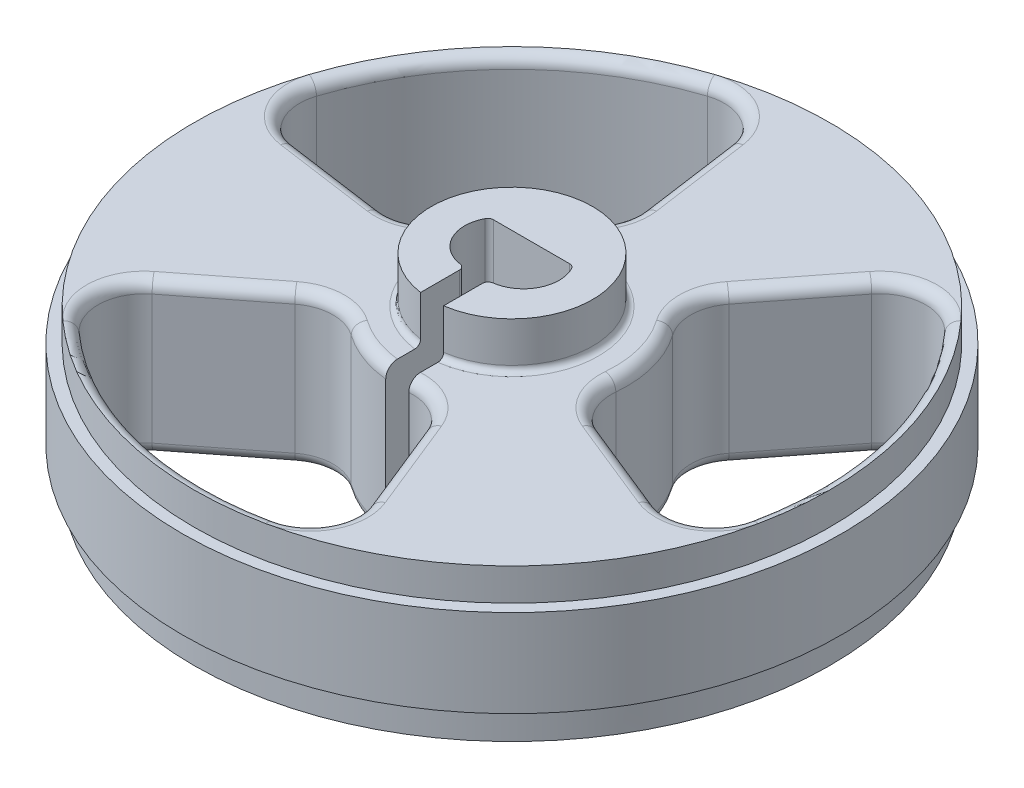
from build123d import *

# Parameters (mm, degrees)
CUT_EXTRUDE1_DEPTH       = 22.272987566
FILLET1_R                = 2
FILLET2_R                = 0.5
CIRPATTERN1_COUNT        = 3
FILLET1_OF_CIRPATTERN1_R = 2
FILLET2_OF_CIRPATTERN1_R = 0.5
CUT_EXTRUDE3_DEPTH       = 22.975895925
FILLET3_R                = 0.25
FILLET4_R                = 0.25


with BuildPart() as part:
    # Sketch1 → Revolve1 (revolve)
    with BuildSketch(Plane(origin=(0, 0, 0), x_dir=(0, 0, -1), z_dir=(1, 0, 0)), mode=Mode.PRIVATE) as revolve1_sk:
        Polygon((0, -4.3), (13.8, -4.3), (13.8, -2.9), (14.3, -2.9), (14.3, 0.9), (13.8, 0.9), (13.8, 2.3), (3.5, 2.3), (3.5, 4.3), (0, 4.3), align=None)
    revolve(revolve1_sk.sketch.rotate(Axis((0, 7.622905435, 0), (0, -1, 0)), 180), axis=Axis((0, 7.622905435, 0), (0, -1, 0)))

    # Sketch2 → Cut-Extrude1 (cut, through all)
    with BuildSketch(Plane(origin=(0, 2.3, 0), x_dir=(1, 0, 0), z_dir=(0, 1, 0))):
        with BuildLine():
            Line((-1.851002243, 13.170565314), (-0.695865505, 4.951340344))
            ThreePointArc((-0.695865505, 4.951340344), (-3.535533906, 3.535533906), (-4.951340344, 0.695865505))
            Line((-4.951340344, 0.695865505), (-13.170565314, 1.851002243))
            ThreePointArc((-13.170565314, 1.851002243), (-9.40452019, 9.40452019), (-1.851002243, 13.170565314))
        make_face()
    cut_extrude1 = extrude(amount=-CUT_EXTRUDE1_DEPTH, mode=Mode.SUBTRACT)

    # Fillet1
    fillet1_edges = [part.edges().sort_by_distance(p)[0] for p in [
        (-13.170565314, -1, -1.851002243),
        (-1.851002243, -1, -13.170565314),
        (-0.695865505, -1, -4.951340344),
        (-4.951340344, -1, -0.695865505),
    ]]
    fillet(fillet1_edges, radius=FILLET1_R)

    # Fillet2
    fillet2_edges = [part.edges().sort_by_distance(p)[0] for p in [
        (-3.535533906, 2.3, -3.535533906),
        (-3.535533906, -4.3, -3.535533906),
        (-8.828143052, 2.3, -1.240714593),
        (-8.828143052, -4.3, -1.240714593),
        (-1.240714593, 2.3, -8.828143052),
        (-1.240714593, -4.3, -8.828143052),
        (-9.40452019, 2.3, -9.40452019),
        (-9.40452019, -4.3, -9.40452019),
        (-5.404150679, 2.3, -1.159832365),
        (-5.404150679, -4.3, -1.159832365),
        (-1.159832365, 2.3, -5.404150679),
        (-1.159832365, -4.3, -5.404150679),
        (-12.432912873, 2.3, -2.471406383),
        (-12.432912873, -4.3, -2.471406383),
        (-2.471406383, 2.3, -12.432912873),
        (-2.471406383, -4.3, -12.432912873),
    ]]
    fillet(fillet2_edges, radius=FILLET2_R - 0.0001)  # a hair under: the kernel refuses the full size

    # CirPattern1: Cut-Extrude1 ×3 about axis
    cirpattern1_axis = Axis((0, 0, 0), (0, 1, 0))
    for i in range(1, CIRPATTERN1_COUNT):
        add(cut_extrude1.rotate(cirpattern1_axis, i * 360 / CIRPATTERN1_COUNT), mode=Mode.SUBTRACT)

    # Fillet1 of CirPattern1
    fillet1_of_cirpattern1_edges = [part.edges().sort_by_distance(p)[0] for p in [
        (4.982267692, -1, 12.331545266),
        (-10.480543023, -1, 8.188297622),
        (-3.940053768, -1, 3.078307377),
        (1.873032967, -1, 4.635919273),
        (8.188297622, -1, -10.480543023),
        (12.331545266, -1, 4.982267692),
        (4.635919273, -1, 1.873032967),
        (3.078307377, -1, -3.940053768),
    ]]
    fillet(fillet1_of_cirpattern1_edges, radius=FILLET1_OF_CIRPATTERN1_R)

    # Fillet2 of CirPattern1
    fillet2_of_cirpattern1_edges = [part.edges().sort_by_distance(p)[0] for p in [
        (-1.294095226, 2.3, 4.829629131),
        (-1.294095226, -4.3, 4.829629131),
        (3.339581169, 2.3, 8.265753448),
        (3.339581169, -4.3, 8.265753448),
        (-7.025038855, 2.3, 5.488561883),
        (-7.025038855, -4.3, 5.488561883),
        (-3.4422933, 2.3, 12.84681349),
        (-3.4422933, -4.3, 12.84681349),
        (1.697631047, 2.3, 5.260047957),
        (1.697631047, -4.3, 5.260047957),
        (-4.100215591, 2.3, 3.706519632),
        (-4.100215591, -4.3, 3.706519632),
        (4.076155726, 2.3, 12.002921582),
        (4.076155726, -4.3, 12.002921582),
        (-9.5315152, 2.3, 8.356757147),
        (-9.5315152, -4.3, 8.356757147),
        (4.829629131, 2.3, -1.294095226),
        (4.829629131, -4.3, -1.294095226),
        (5.488561883, 2.3, -7.025038855),
        (5.488561883, -4.3, -7.025038855),
        (8.265753448, 2.3, 3.339581169),
        (8.265753448, -4.3, 3.339581169),
        (12.84681349, 2.3, -3.4422933),
        (12.84681349, -4.3, -3.4422933),
        (3.706519632, 2.3, -4.100215591),
        (3.706519632, -4.3, -4.100215591),
        (5.260047957, 2.3, 1.697631047),
        (5.260047957, -4.3, 1.697631047),
        (8.356757147, 2.3, -9.5315152),
        (8.356757147, -4.3, -9.5315152),
        (12.002921582, 2.3, 4.076155726),
        (12.002921582, -4.3, 4.076155726),
    ]]
    fillet(fillet2_of_cirpattern1_edges, radius=FILLET2_OF_CIRPATTERN1_R - 0.0001)  # a hair under: the kernel refuses the full size

    # Sketch3 → Cut-Extrude3 (cut, through all)
    with BuildSketch(Plane(origin=(0, 4.3, 0), x_dir=(1, 0, 0), z_dir=(0, 1, 0))):
        with BuildLine():
            Line((-0.5, -5.55), (-0.5, -1.55))
            ThreePointArc((-0.5, -1.55), (-1.86381817, -0.736545993), (-1.79614814, 0.85))
            Line((-1.79614814, 0.85), (1.79614814, 0.85))
            ThreePointArc((1.79614814, 0.85), (1.86381817, -0.736545993), (0.5, -1.55))
            Line((0.5, -1.55), (0.5, -5.55))
            Line((0.5, -5.55), (-0.5, -5.55))
        make_face()
    extrude(amount=-CUT_EXTRUDE3_DEPTH, mode=Mode.SUBTRACT)

    # Fillet3
    fillet3_edges = [part.edges().sort_by_distance(p)[0] for p in [
        (0.5, 0, 1.55),
        (-0.5, 0, 1.55),
        (-1.79614814, 0, -0.85),
        (1.79614814, 0, -0.85),
    ]]
    fillet(fillet3_edges, radius=FILLET3_R)

    # Fillet4
    fillet4_edges = [part.edges().sort_by_distance(p)[0] for p in [
        (0, 2.3, -3.5),
    ]]
    fillet(fillet4_edges, radius=FILLET4_R)


solid = part.part
